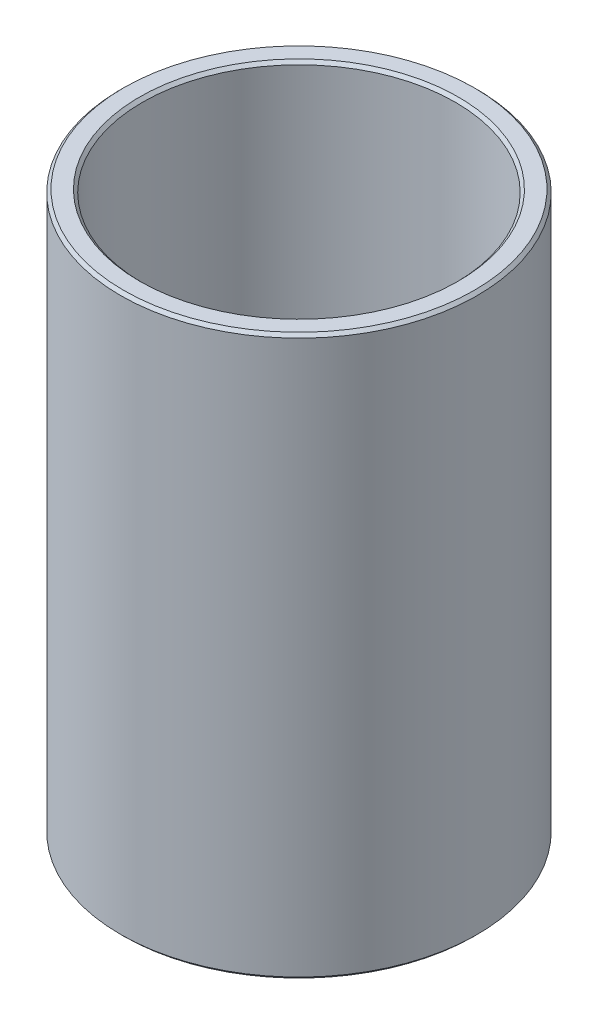
from build123d import *

# Parameters (mm, degrees)
SKETCH1_R           = 32.5
BOSS_EXTRUDE1_DEPTH = 101.904696783
SKETCH2_R           = 28.505180443
CUT_EXTRUDE1_DEPTH  = 112.790282343
CHAMFER1_SIZE       = 0.548224534


with BuildPart() as part:
    # Sketch1 → Boss-Extrude1 (new body)
    with BuildSketch(Plane(origin=(0, 0, 0), x_dir=(1, 0, 0), z_dir=(0, 1, 0))):
        Circle(SKETCH1_R)
    extrude(amount=BOSS_EXTRUDE1_DEPTH)

    # Sketch2 → Cut-Extrude1 (cut, through all)
    with BuildSketch(Plane(origin=(0, 0, 0), x_dir=(1, 0, 0), z_dir=(0, 1, 0))):
        Circle(SKETCH2_R)
    extrude(amount=CUT_EXTRUDE1_DEPTH, mode=Mode.SUBTRACT)

    # Chamfer1
    chamfer1_edges = [part.edges().sort_by_distance(p)[0] for p in [
        (-28.505180443, 101.904696783, 0),
        (-28.505180443, 0, 0),
        (-32.5, 0, 0),
        (-32.5, 101.904696783, 0),
    ]]
    chamfer(chamfer1_edges, length=CHAMFER1_SIZE)


solid = part.part
